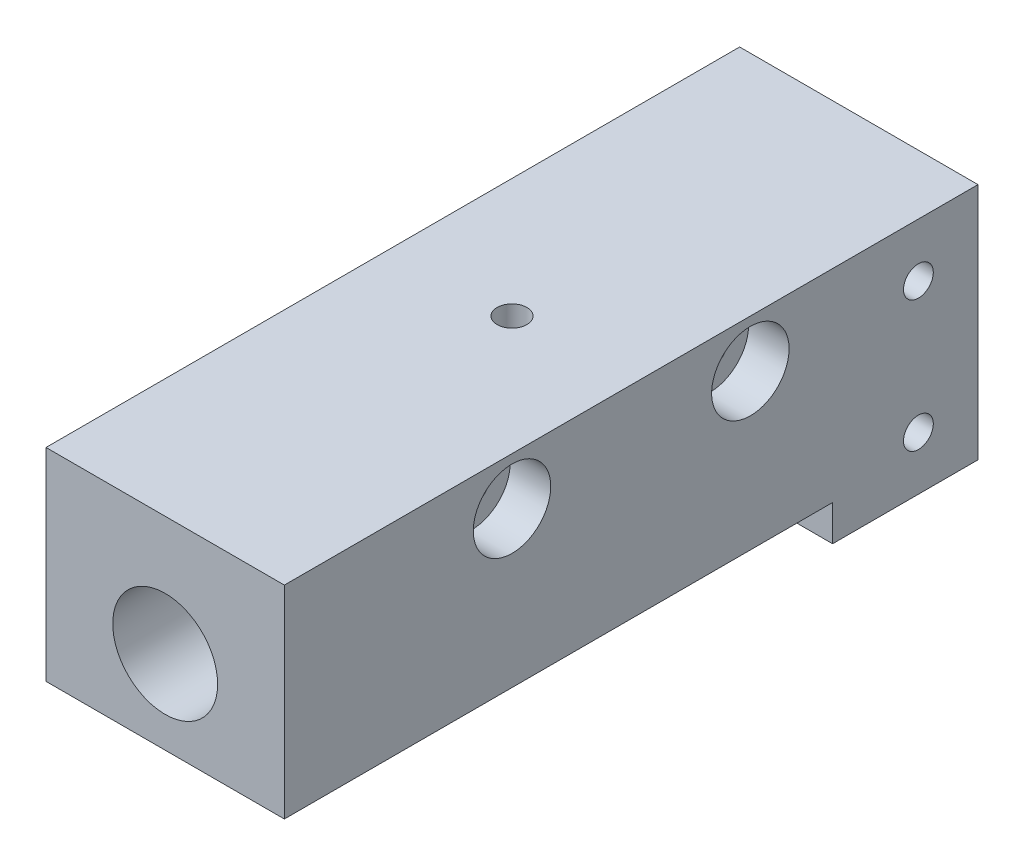
from build123d import *

# Parameters (mm, degrees)
SCHIZZO1_W                                          = 20
SCHIZZO1_H                                          = 20
ESTRUSIONE_ESTRUSIONE1_DEPTH                        = 58.2
SCHIZZO2_R                                          = 3
TAGLIO_ESTRUSIONE1_DEPTH                            = 60.893572276
FORO_FILETTATO_G1_8_1_D                             = 8.8
FORO_FILETTATO_G1_8_1_DEPTH                         = 10
FORO_FILETTATO_G1_8_1_TIP                           = 2.643786724
TAGLIO_ESTRUSIONE5_DEPTH                            = 63.347734522
TAGLIO_ESTRUSIONE5_DEPTH_BACK                       = 63.347734522
FORO_FILETTATO_M3_1_D                               = 2.5
FORO_FILETTATO_M3_1_DEPTH                           = 5
FORO_FILETTATO_M3_1_TIP                             = 0.751075774
FORO_FILETTATO_M3_2_D                               = 2.5
CBORE_FOR_M3_HEX_SOCKET_HEAD_CAP_SCREW1_D           = 3.2
CBORE_FOR_M3_HEX_SOCKET_HEAD_CAP_SCREW1_CBORE_D     = 6.5
CBORE_FOR_M3_HEX_SOCKET_HEAD_CAP_SCREW1_CBORE_DEPTH = 3.4


with BuildPart() as part:
    # Schizzo1 → Estrusione-Estrusione1 (new body)
    with BuildSketch(Plane.XY):
        Rectangle(SCHIZZO1_W, SCHIZZO1_H)
    extrude(amount=-ESTRUSIONE_ESTRUSIONE1_DEPTH)

    # Schizzo2 → Taglio-Estrusione1 (cut, through all)
    with BuildSketch(Plane(origin=(0, 0, -58.2), x_dir=(-1, 0, 0), z_dir=(0, 0, -1))):
        Circle(SCHIZZO2_R)
    extrude(amount=-TAGLIO_ESTRUSIONE1_DEPTH, mode=Mode.SUBTRACT)

    # Foro filettato G1/8-1
    with Locations(Plane.XY):
        with Locations((0, 0)):
            Hole(FORO_FILETTATO_G1_8_1_D / 2, depth=FORO_FILETTATO_G1_8_1_DEPTH)
            with Locations((0, 0, -(FORO_FILETTATO_G1_8_1_DEPTH + FORO_FILETTATO_G1_8_1_TIP / 2))):  # 118° drill point
                Cone(0, FORO_FILETTATO_G1_8_1_D / 2, FORO_FILETTATO_G1_8_1_TIP, mode=Mode.SUBTRACT)

    # Schizzo10 → Taglio-Estrusione5 (cut, two sides: drawn at the far end of the back side and taken through both)
    with BuildSketch(Plane(origin=(10, 0, 0), x_dir=(0, 0, -1), z_dir=(1, 0, 0)).offset(-TAGLIO_ESTRUSIONE5_DEPTH_BACK)):
        Polygon((-131.2640095, -7), (0, -7), (46, -7), (46, -10), (46, -141.2640095), (-112.509379382, -350.53832089), (-289.773388882, -216.27431139), align=None)
    extrude(amount=TAGLIO_ESTRUSIONE5_DEPTH + TAGLIO_ESTRUSIONE5_DEPTH_BACK, mode=Mode.SUBTRACT)

    # Foro filettato M3-1
    with Locations(Plane(origin=(0, 10, -29.1), x_dir=(1, 0, 0), z_dir=(0, 1, 0))):
        with Locations((0, 0)):
            Hole(FORO_FILETTATO_M3_1_D / 2, depth=FORO_FILETTATO_M3_1_DEPTH)
            with Locations((0, 0, -(FORO_FILETTATO_M3_1_DEPTH + FORO_FILETTATO_M3_1_TIP / 2))):  # 118° drill point
                Cone(0, FORO_FILETTATO_M3_1_D / 2, FORO_FILETTATO_M3_1_TIP, mode=Mode.SUBTRACT)

    # Schizzo14 → Foro Ø16.0 (16)-1 (revolve, cut)
    with BuildSketch(Plane(origin=(0, 0, -58.2), x_dir=(0, 1, 0), z_dir=(1, 0, 0))):
        Polygon((0, 0), (0, 16.806884952), (8, 12), (8, 0), align=None)
    revolve(axis=Axis((0, 0, -64.55), (0, 0, 1)), mode=Mode.SUBTRACT)

    # Foro filettato M3-2 (through all)
    with Locations(Plane(origin=(10, 5.5, -53.2), x_dir=(0, 0, 1), z_dir=(1, 0, 0))):
        with Locations((0, 0), (0, 11)):
            Hole(FORO_FILETTATO_M3_2_D / 2)

    # CBORE for M3 Hex Socket Head Cap Screw1 (through all)
    with Locations(Plane(origin=(10, 6, -19.1), x_dir=(0, 0, 1), z_dir=(1, 0, 0))):
        with Locations((0, 0), (-20, 0)):
            CounterBoreHole(CBORE_FOR_M3_HEX_SOCKET_HEAD_CAP_SCREW1_D / 2, CBORE_FOR_M3_HEX_SOCKET_HEAD_CAP_SCREW1_CBORE_D / 2, CBORE_FOR_M3_HEX_SOCKET_HEAD_CAP_SCREW1_CBORE_DEPTH)


solid = part.part
